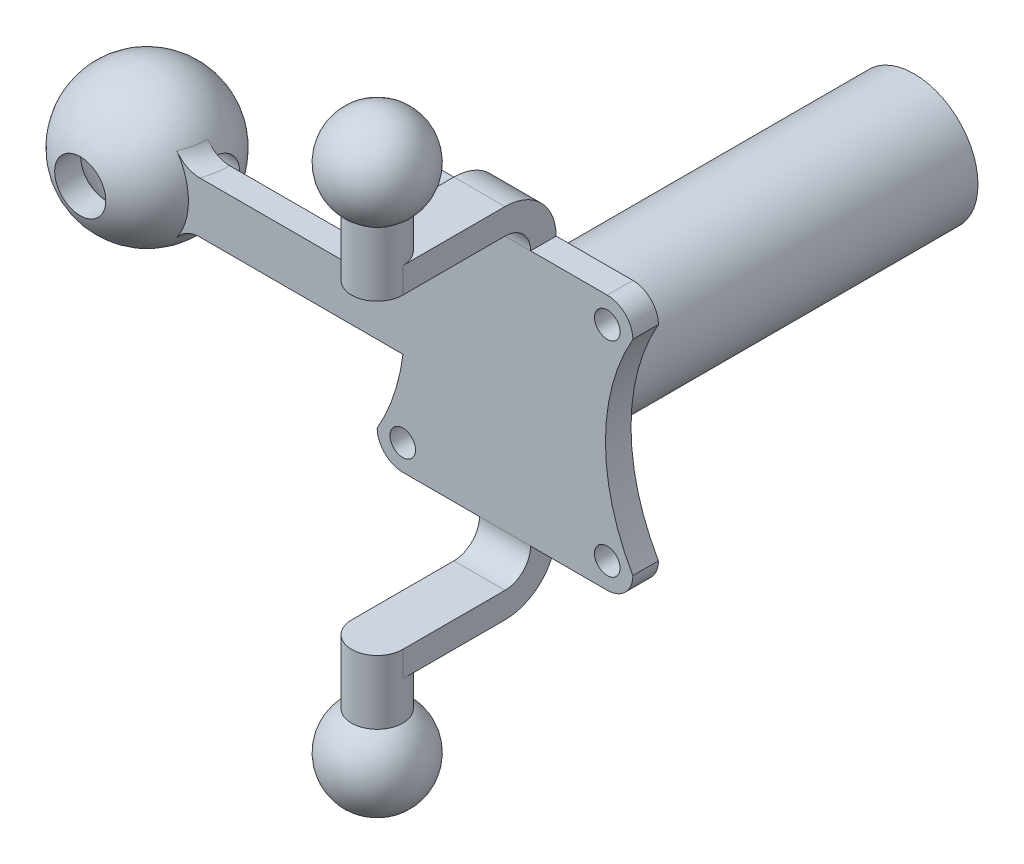
from build123d import *

# Parameters (mm, degrees)
BOSS_EXTRUDE1_DEPTH  = 10
CUT_EXTRUDE1_DEPTH   = 10
SKETCH6_W            = 20
SKETCH6_H            = 10
BOSS_EXTRUDE5_DEPTH  = 10
SKETCH7_W            = 20
SKETCH7_H            = 10
BOSS_EXTRUDE6_DEPTH  = 60
FILLET7_R            = 20
FILLET8_R            = 10
BOSS_EXTRUDE7_DEPTH  = 10
CUT_EXTRUDE7_DEPTH   = 18
FILLET7_OF_MIRROR2_R = 20
FILLET8_OF_MIRROR2_R = 10
SKETCH19_R           = 5
CUT_EXTRUDE9_DEPTH   = 30
SKETCH29_R           = 10
BOSS_EXTRUDE16_DEPTH = 15
SKETCH31_R           = 10
BOSS_EXTRUDE17_DEPTH = 15
BOSS_EXTRUDE21_DEPTH = 10
FILLET9_R            = 10
FILLET10_R           = 10
SKETCH35_R           = 10
CUT_EXTRUDE11_DEPTH  = 30
SKETCH16_R           = 25
BOSS_EXTRUDE22_DEPTH = 150


with BuildPart() as part:
    # Sketch2 → Boss-Extrude1 (new body)
    with BuildSketch(Plane.XY):
        with BuildLine():
            Line((-40, 50), (40, 50))
            ThreePointArc((40, 50), (47.071067812, 47.071067812), (50, 40))
            Line((50, 40), (50, -40))
            ThreePointArc((50, -40), (47.071067812, -47.071067812), (40, -50))
            Line((40, -50), (-40, -50))
            ThreePointArc((-40, -50), (-47.071067812, -47.071067812), (-50, -40))
            Line((-50, -40), (-50, 40))
            ThreePointArc((-50, 40), (-47.071067812, 47.071067812), (-40, 50))
        make_face()
    boss_extrude1 = extrude(amount=BOSS_EXTRUDE1_DEPTH)

    # Sketch3 → Cut-Extrude1 (cut)
    with BuildSketch(Plane.XY.offset(10)):
        with BuildLine():
            Line((-50, 40), (-50, -40))
            ThreePointArc((-50, -40), (-39.282032303, 0), (-50, 40))
        make_face()
        with BuildLine():
            Line((50, 40), (50, -40))
            ThreePointArc((50, -40), (39.282032303, 0), (50, 40))
        make_face()
    cut_extrude1 = extrude(amount=-CUT_EXTRUDE1_DEPTH, mode=Mode.SUBTRACT)

    # Sketch6 → Boss-Extrude5 (add)
    with BuildSketch(Plane.XZ.offset(50)):
        with Locations((0, 5)):
            Rectangle(SKETCH6_W, SKETCH6_H)
    boss_extrude5 = extrude(amount=BOSS_EXTRUDE5_DEPTH)

    # Sketch7 → Boss-Extrude6 (add)
    with BuildSketch(Plane.XY):
        with Locations((0, -65)):
            Rectangle(SKETCH7_W, SKETCH7_H)
    boss_extrude6 = extrude(amount=BOSS_EXTRUDE6_DEPTH)

    # Fillet7
    fillet7_edges = [part.edges().sort_by_distance(p)[0] for p in [
        (0, -70, 0),
    ]]
    fillet(fillet7_edges, radius=FILLET7_R)

    # Fillet8
    fillet8_edges = [part.edges().sort_by_distance(p)[0] for p in [
        (0, -60, 10),
    ]]
    fillet(fillet8_edges, radius=FILLET8_R)

    # Sketch8 → Boss-Extrude7 (add)
    with BuildSketch(Plane(origin=(0, -60, 0), x_dir=(1, 0, 0), z_dir=(0, 1, 0))):
        with BuildLine():
            Line((10, -60), (-10, -60))
            ThreePointArc((-10, -60), (0, -70), (10, -60))
        make_face()
    boss_extrude7 = extrude(amount=-BOSS_EXTRUDE7_DEPTH)

    # Sketch14 → Cut-Extrude7 (cut)
    with BuildSketch(Plane.XY.offset(10)):
        with BuildLine():
            Line((-39.282032303, 0), (39.282032303, 0))
            add(Edge.make_bspline(
                [(50, 40), (39.359472874, 21.350658255), (39.282032303, 0)],
                knots=[0, 0, 0, 1, 1, 1], degree=2))
            add(Edge.make_bspline(
                [(40, 50), (49.142135624, 49.142135624), (50, 40)],
                knots=[0, 0, 0, 1, 1, 1], degree=2))
            Line((40, 50), (-40, 50))
            add(Edge.make_bspline(
                [(-50, 40), (-49.142135624, 49.142135624), (-40, 50)],
                knots=[0, 0, 0, 1, 1, 1], degree=2))
            add(Edge.make_bspline(
                [(-39.282032303, 0), (-39.359472874, 21.350658255), (-50, 40)],
                knots=[0, 0, 0, 1, 1, 1], degree=2))
        make_face()
    extrude(amount=-CUT_EXTRUDE7_DEPTH, mode=Mode.SUBTRACT)


with BuildPart() as cut_extrude7_kept_piece:
    # of the separate pieces the step leaves, the one the design keeps (cut_extrude7_pieces_kept)
    add(part.part.solids().sort_by_distance((-10, -60, 20))[0])

    # Mirror2: Boss-Extrude1, Cut-Extrude1, Boss-Extrude5, Boss-Extrude6, Boss-Extrude7 across plane
    add(boss_extrude1.mirror(Plane(origin=(-39.282032303, 0, -8), x_dir=(0, 0, 1), z_dir=(0, -1, 0))))
    add(cut_extrude1.mirror(Plane(origin=(-39.282032303, 0, -8), x_dir=(0, 0, 1), z_dir=(0, -1, 0))), mode=Mode.SUBTRACT)
    add(boss_extrude5.mirror(Plane(origin=(-39.282032303, 0, -8), x_dir=(0, 0, 1), z_dir=(0, -1, 0))))
    add(boss_extrude6.mirror(Plane(origin=(-39.282032303, 0, -8), x_dir=(0, 0, 1), z_dir=(0, -1, 0))))
    add(boss_extrude7.mirror(Plane(origin=(-39.282032303, 0, -8), x_dir=(0, 0, 1), z_dir=(0, -1, 0))))

    # Fillet7 of Mirror2
    fillet7_of_mirror2_edges = [cut_extrude7_kept_piece.edges().sort_by_distance(p)[0] for p in [
        (0, 70, 0),
    ]]
    fillet(fillet7_of_mirror2_edges, radius=FILLET7_OF_MIRROR2_R)

    # Fillet8 of Mirror2
    fillet8_of_mirror2_edges = [cut_extrude7_kept_piece.edges().sort_by_distance(p)[0] for p in [
        (0, 60, 10),
    ]]
    fillet(fillet8_of_mirror2_edges, radius=FILLET8_OF_MIRROR2_R)

    # Sketch19 → Cut-Extrude9 (cut)
    with BuildSketch(Plane.XY.offset(10)):
        with Locations((-40, 40)):
            Circle(SKETCH19_R)
        with Locations((40, 40)):
            Circle(SKETCH19_R)
        with Locations((-40, -40)):
            Circle(SKETCH19_R)
        with Locations((40, -40)):
            Circle(SKETCH19_R)
    extrude(amount=-CUT_EXTRUDE9_DEPTH, mode=Mode.SUBTRACT)

    # Sketch29 → Boss-Extrude16 (add)
    with BuildSketch(Plane(origin=(0, 70, 0), x_dir=(1, 0, 0), z_dir=(0, 1, 0))):
        with Locations(Location((0, -60, 0), (0, 0, 180))):
            Circle(SKETCH29_R)
    extrude(amount=BOSS_EXTRUDE16_DEPTH)

    # Sketch30 → Revolve2 (revolve)
    with BuildSketch(Plane(origin=(0, 0, 0), x_dir=(0, 0, -1), z_dir=(1, 0, 0))):
        with BuildLine():
            Line((-60, 118.027756377), (-60, 85))
            Line((-60, 85), (-50, 85))
            ThreePointArc((-50, 85), (-42.745778116, 105.224158035), (-60, 118.027756377))
        make_face()
    revolve(axis=Axis((0, 85, 60), (0, 1, 0)))

    # Sketch31 → Boss-Extrude17 (add)
    with BuildSketch(Plane.XZ.offset(70)):
        with Locations(Location((0, 60, 0), (0, 0, 180))):
            Circle(SKETCH31_R)
    extrude(amount=BOSS_EXTRUDE17_DEPTH)

    # Sketch32 → Revolve3 (revolve)
    with BuildSketch(Plane(origin=(0, 0, 0), x_dir=(0, 0, -1), z_dir=(1, 0, 0))):
        with BuildLine():
            Line((-60, -118.027756377), (-60, -85))
            Line((-60, -85), (-70, -85))
            ThreePointArc((-70, -85), (-77.254221884, -105.224158035), (-60, -118.027756377))
        make_face()
    revolve(axis=Axis((0, -85, 60), (0, -1, 0)))

    # Sketch33 → Boss-Extrude21 (add)
    with BuildSketch(Plane.XY.offset(10)):
        with BuildLine():
            Line((-134, 10), (-39.909492971, 10))
            ThreePointArc((-39.909492971, 10), (-39.282032303, 0), (-39.909492971, -10))
            Line((-39.909492971, -10), (-134, -10))
            Line((-134, -10), (-134, 10))
        make_face()
    extrude(amount=-BOSS_EXTRUDE21_DEPTH)

    # Sketch34 → Revolve5 (revolve)
    with BuildSketch(Plane.XY):
        with BuildLine():
            Line((-178, 0), (-168.867962264, 0))
            ThreePointArc((-168.867962264, 0), (-155.201567253, 18.136805069), (-134, 10))
            Line((-134, 10), (-123.846606339, 10))
            ThreePointArc((-123.846606339, 10), (-155.08453427, 27.534478591), (-178, 0))
        make_face()
    revolve(axis=Axis((-134, 0, 0), (-1, 0, 0)))

    # Fillet9
    # the kernel refuses this fillet: 10 mm, written as the material it adds along each edge
    with BuildSketch(Plane(origin=(-150, 10, 0), x_dir=(1, 0, 0), z_dir=(0, 0, -1))) as fillet9_piece_1_section:
        with BuildLine():
            CenterArc((32.310988843, -10), FILLET9_R, 90, 58.243136141)
            ThreePointArc((23.808097042, -4.736842105), (25.09276901, -2.423886002), (26.153393661, 0))
            Line((26.153393661, 0), (32.310988843, 0))
        make_face()
    fillet9_piece_1 = revolve(axis=Axis((-150, 10, 0), (0, -1, 0)), revolution_arc=56.205276657, mode=Mode.PRIVATE)
    fillet9_piece_1 = split(fillet9_piece_1, bisect_by=Plane(origin=(-123.595029593, 11.027181376, 10), z_dir=(0, 0, -1)), keep=Keep.TOP, mode=Mode.PRIVATE)
    add(fillet9_piece_1)

    # Fillet10
    # the kernel refuses this fillet: 10 mm, written as the material it adds along each edge
    with BuildSketch(Plane(origin=(-150, -10, 0), x_dir=(0.5562190835944724, 0, 0.8310356978164808), z_dir=(-0.8310356978164808, 0, 0.5562190835944724))) as fillet10_piece_1_section:
        with BuildLine():
            CenterArc((32.310988843, -10), FILLET10_R, 90, 58.243136141)
            ThreePointArc((23.808097042, -4.736842105), (25.09276901, -2.423886002), (26.153393661, 0))
            Line((26.153393661, 0), (32.310988843, 0))
        make_face()
    fillet10_piece_1 = revolve(axis=Axis((-150, -10, 0), (0, 1, 0)), revolution_arc=56.205276657, mode=Mode.PRIVATE)
    fillet10_piece_1 = split(fillet10_piece_1, bisect_by=Plane(origin=(-123.595029593, -11.027181376, 10), z_dir=(0, 0, -1)), keep=Keep.TOP, mode=Mode.PRIVATE)
    add(fillet10_piece_1)

    # Sketch35 → Cut-Extrude11 (cut)
    with BuildSketch(Plane.XY):
        with Locations(Location((-150, 0, 0), (0, 0, 180))):
            Circle(SKETCH35_R)
    extrude(amount=CUT_EXTRUDE11_DEPTH, mode=Mode.SUBTRACT)

    # Sketch16 → Boss-Extrude22 (add)
    with BuildSketch(Plane(origin=(0, 0, 0), x_dir=(-1, 0, 0), z_dir=(0, 0, -1))):
        with Locations(Location((0, 0, 0), (0, 0, 180))):
            Circle(SKETCH16_R)
    extrude(amount=BOSS_EXTRUDE22_DEPTH)


solid = cut_extrude7_kept_piece.part
